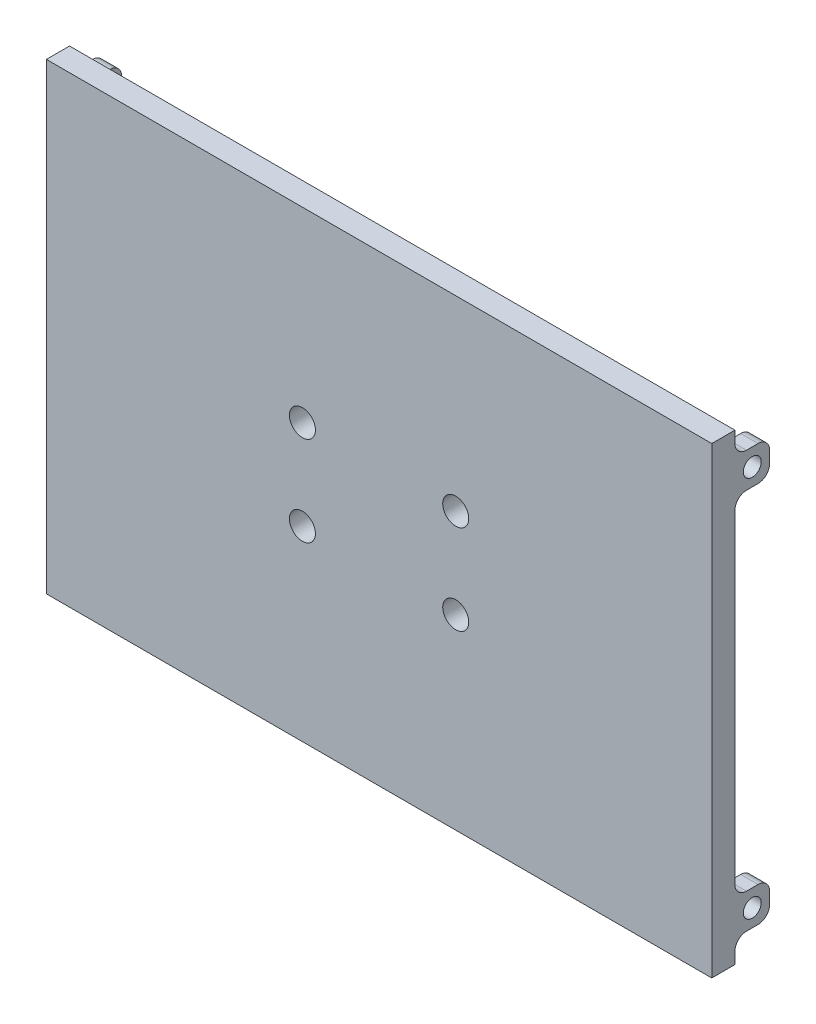
from build123d import *

# Parameters (mm, degrees)
SKETCH1_W               = 80
SKETCH1_H               = 115
BOSS_EXTRUDE1_DEPTH     = 4
CUT_EXTRUDE1_REACH      = 72.159
SKETCH2_R               = 2.25
SKETCH4_W               = 3
SKETCH4_H               = 6
BOSS_EXTRUDE3_DEPTH     = 6
CUT_EXTRUDE2_DEPTH      = 122.905701261
CUT_EXTRUDE2_DEPTH_BACK = 122.905701261
SKETCH5_R               = 1.55
FILLET1_R               = 2


with BuildPart() as part:
    # Sketch1 → Boss-Extrude1 (new body)
    with BuildSketch(Plane(origin=(0, 0, 0), x_dir=(0, 1, 0), z_dir=(0, 0, 1))):
        Rectangle(SKETCH1_W, SKETCH1_H)
    extrude(amount=BOSS_EXTRUDE1_DEPTH)

    # Sketch2 → Cut-Extrude1 (cut, up to next)
    with BuildSketch(Plane.XY.offset(4), mode=Mode.PRIVATE) as cut_extrude1_sk1:
        with Locations((13.25, 7.75)):
            Circle(SKETCH2_R)
    cut_extrude1_tool1 = extrude(cut_extrude1_sk1.sketch, amount=-CUT_EXTRUDE1_REACH, mode=Mode.PRIVATE) & part.part
    # Sketch2 → Cut-Extrude1 (cut, up to next)
    with BuildSketch(Plane.XY.offset(4), mode=Mode.PRIVATE) as cut_extrude1_sk2:
        with Locations((-13.25, 7.75)):
            Circle(SKETCH2_R)
    cut_extrude1_tool2 = extrude(cut_extrude1_sk2.sketch, amount=-CUT_EXTRUDE1_REACH, mode=Mode.PRIVATE) & part.part
    # Sketch2 → Cut-Extrude1 (cut, up to next)
    with BuildSketch(Plane.XY.offset(4), mode=Mode.PRIVATE) as cut_extrude1_sk3:
        with Locations((13.25, -7.75)):
            Circle(SKETCH2_R)
    cut_extrude1_tool3 = extrude(cut_extrude1_sk3.sketch, amount=-CUT_EXTRUDE1_REACH, mode=Mode.PRIVATE) & part.part
    # Sketch2 → Cut-Extrude1 (cut, up to next)
    with BuildSketch(Plane.XY.offset(4), mode=Mode.PRIVATE) as cut_extrude1_sk4:
        with Locations((-13.25, -7.75)):
            Circle(SKETCH2_R)
    cut_extrude1_tool4 = extrude(cut_extrude1_sk4.sketch, amount=-CUT_EXTRUDE1_REACH, mode=Mode.PRIVATE) & part.part
    add(cut_extrude1_tool1.solids().sort_by_distance((13.25, 7.75, 4))[0], mode=Mode.SUBTRACT)
    add(cut_extrude1_tool2.solids().sort_by_distance((-13.25, 7.75, 4))[0], mode=Mode.SUBTRACT)
    add(cut_extrude1_tool3.solids().sort_by_distance((13.25, -7.75, 4))[0], mode=Mode.SUBTRACT)
    add(cut_extrude1_tool4.solids().sort_by_distance((-13.25, -7.75, 4))[0], mode=Mode.SUBTRACT)

    # Sketch4 → Boss-Extrude3 (add)
    with BuildSketch(Plane(origin=(0, 0, 0), x_dir=(1, 0, 0), z_dir=(0, 0, -1))):
        with Locations((-56, 33)):
            Rectangle(SKETCH4_W, SKETCH4_H)
        with Locations((56, 33)):
            Rectangle(SKETCH4_W, SKETCH4_H)
        with Locations((-56, -33)):
            Rectangle(SKETCH4_W, SKETCH4_H)
        with Locations((56, -33)):
            Rectangle(SKETCH4_W, SKETCH4_H)
    extrude(amount=BOSS_EXTRUDE3_DEPTH)

    # Sketch5 → Cut-Extrude2 (cut, two sides: drawn at the far end of the back side and taken through both)
    with BuildSketch(Plane.YZ.offset(57.5).offset(-CUT_EXTRUDE2_DEPTH_BACK)):
        with Locations((-33, -3)):
            Circle(SKETCH5_R)
        with Locations((33, -3)):
            Circle(SKETCH5_R)
    extrude(amount=CUT_EXTRUDE2_DEPTH + CUT_EXTRUDE2_DEPTH_BACK, mode=Mode.SUBTRACT)

    # Fillet1
    fillet1_edges = [part.edges().sort_by_distance(p)[0] for p in [
        (-56, 30, 0),
        (-56, 36, 0),
        (-56, 36, -6),
        (-56, 30, -6),
        (-56, -30, 0),
        (-56, -30, -6),
        (-56, -36, -6),
        (-56, -36, 0),
        (56, 30, 0),
        (56, 30, -6),
        (56, 36, -6),
        (56, 36, 0),
        (56, -30, 0),
        (56, -30, -6),
        (56, -36, -6),
        (56, -36, 0),
    ]]
    fillet(fillet1_edges, radius=FILLET1_R)


solid = part.part
